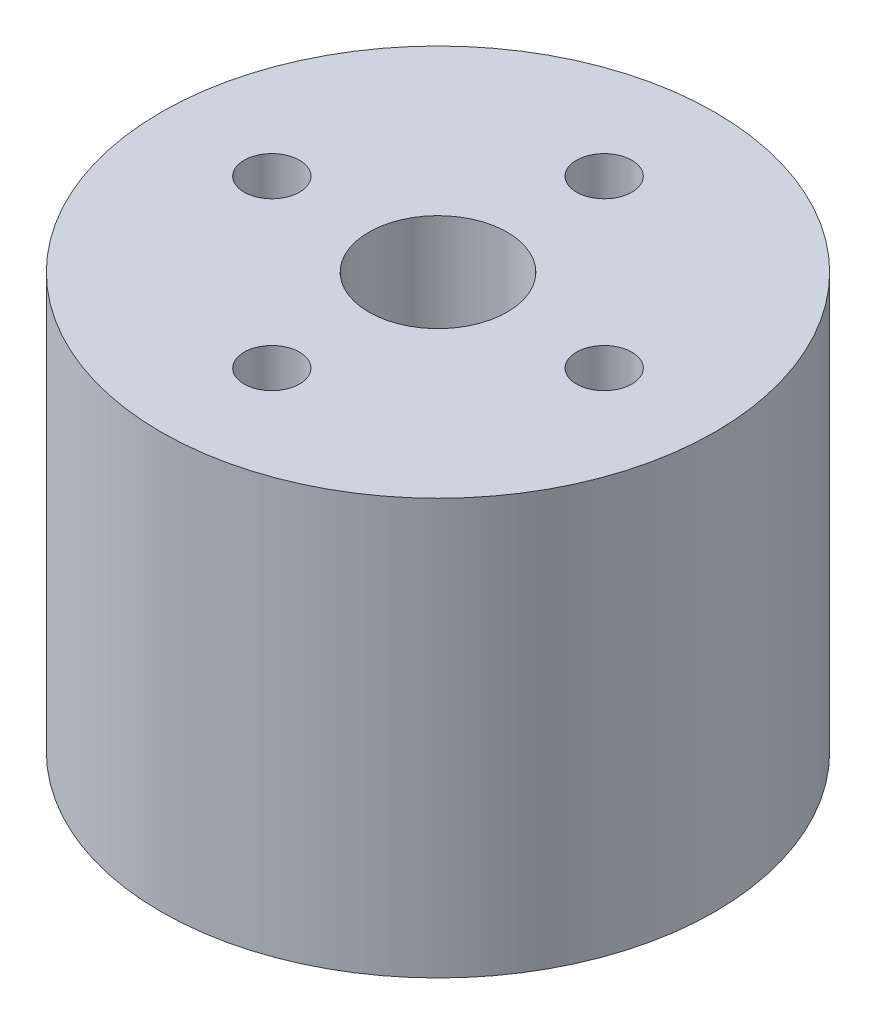
from build123d import *

# Parameters (mm, degrees)
SKETCH_1_R               = 10
SKETCH_1_R_2             = 2.5
EXTRUDE_1_DEPTH          = 15
SKETCH_2_R               = 1
CUT_EXTRUDE_1_DEPTH      = 15
PATTERN_CIRCULAR_1_COUNT = 4


with BuildPart() as part:
    # 草图1 → 凸台-拉伸1 (new body)
    with BuildSketch(Plane(origin=(0, 0, 0), x_dir=(1, 0, 0), z_dir=(0, 1, 0))):
        Circle(SKETCH_1_R)
        Circle(SKETCH_1_R_2, mode=Mode.SUBTRACT)
    extrude(amount=EXTRUDE_1_DEPTH)

    # 草图2 → 切除-拉伸1 (cut)
    with BuildSketch(Plane(origin=(0, 15, 0), x_dir=(1, 0, 0), z_dir=(0, 1, 0))):
        with Locations((-6, 0)):
            Circle(SKETCH_2_R)
    cut_extrude_1 = extrude(amount=-CUT_EXTRUDE_1_DEPTH, mode=Mode.SUBTRACT)

    # 阵列(圆周)1: 切除-拉伸1 ×4 about axis
    pattern_circular_1_axis = Axis((0, 15, 0), (0, -1, 0))
    for i in range(1, PATTERN_CIRCULAR_1_COUNT):
        add(cut_extrude_1.rotate(pattern_circular_1_axis, i * 360 / PATTERN_CIRCULAR_1_COUNT), mode=Mode.SUBTRACT)


solid = part.part
